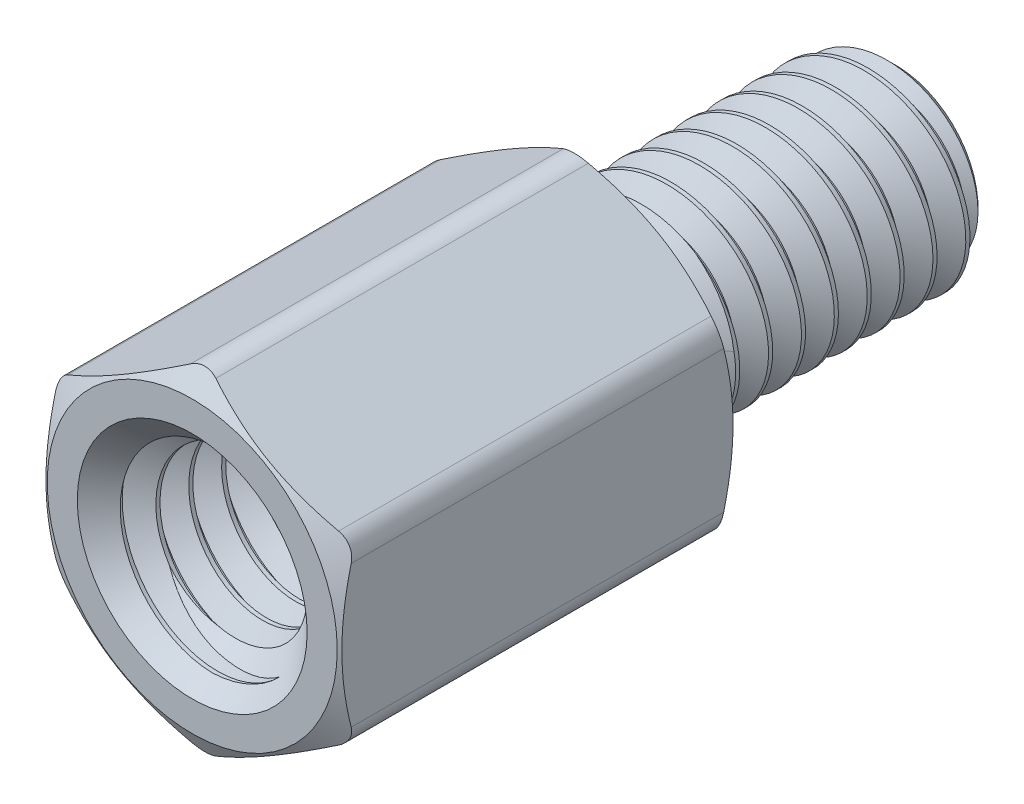
from build123d import *

# Parameters (mm, degrees)
SKETCH4_R           = 1.875
BOSS_EXTRUDE1_DEPTH = 6
SKETCH5_OUTSIDE_W   = 51.438
SKETCH5_OUTSIDE_H   = 52.134
SKETCH5_OUTSIDE_R   = 2.205
CUT_EXTRUDE1_DEPTH  = 12.238438504
CUT_EXTRUDE1_DRAFT  = -60
SKETCH6_OUTSIDE_W   = 36.46
SKETCH6_OUTSIDE_H   = 37.156
SKETCH6_OUTSIDE_R   = 2.205
CUT_EXTRUDE2_DEPTH  = 7.914658343
CUT_EXTRUDE2_DRAFT  = -60
FILLET1_R           = 0.3825
CUT_SWEEP1_PITCH    = 0.5
SKETCH9_R           = 1.75
BOSS_EXTRUDE2_DEPTH = 2.8
SKETCH10_W          = 2.8
SKETCH10_H          = 1.5
CUT_SWEEP2_PITCH    = 0.5


with BuildPart() as part:
    # Sketch3 → Revolve1 (revolve)
    with BuildSketch(Plane(origin=(0, 0, 0), x_dir=(0, 0, -1), z_dir=(1, 0, 0))):
        with BuildLine():
            Line((-3.2, 1.25), (-3.2, 0))
            Line((-3.2, 0), (4.7, 0))
            Line((4.7, 0), (4.7, 1.25))
            Line((4.7, 1.25), (4.45, 1.5))
            Line((4.45, 1.5), (0.7515, 1.5))
            Line((0.7515, 1.5), (0.564, 1.175240474))
            Line((0.564, 1.175240474), (0.25, 1.175240474))
            ThreePointArc((0.25, 1.175240474), (0.073223305, 1.248463778), (0, 1.425240474))
            Line((0, 1.425240474), (0, 2.25))
            Line((0, 2.25), (-6, 2.25))
            Line((-6, 2.25), (-6, 1.75))
            Line((-6, 1.75), (-5.75, 1.5))
            Line((-5.75, 1.5), (-3.45, 1.5))
            Line((-3.45, 1.5), (-3.2, 1.25))
        make_face()
    revolve(axis=Axis((0, 0, -4.7), (0, 0, 1)))

    # Sketch4 → Boss-Extrude1 (add)
    with BuildSketch(Plane.XY.offset(6)):
        Polygon((-2.25, 1.299038106), (-2.25, -1.299038106), (0, -2.598076211), (2.25, -1.299038106), (2.25, 1.299038106), (0, 2.598076211), align=None)
        Circle(SKETCH4_R, mode=Mode.SUBTRACT)
    extrude(amount=-BOSS_EXTRUDE1_DEPTH)


with BuildPart() as cut_extrude1_tool:
    # Sketch5 outside → Cut-Extrude1 (with draft: the straight prism first)
    with BuildSketch(Plane.XY.offset(6)):
        Rectangle(SKETCH5_OUTSIDE_W, SKETCH5_OUTSIDE_H)
        Circle(SKETCH5_OUTSIDE_R, mode=Mode.SUBTRACT)
    extrude(amount=-CUT_EXTRUDE1_DEPTH)
    # Cut-Extrude1: the draft: its side faces are tilted about the plane it starts from
    cut_extrude1_sides = [cut_extrude1_tool.faces().sort_by_distance(p)[0] for p in [
        (0, -26.067, -0.119219252),
        (25.719, 0, -0.119219252),
        (0, 26.067, -0.119219252),
        (-25.719, 0, -0.119219252),
        (-2.205, 0, -0.119219252),
    ]]
    draft(cut_extrude1_sides, Plane.XY.offset(6), CUT_EXTRUDE1_DRAFT)


with BuildPart() as part_1:
    add(part.part)

    # Cut-Extrude1: cut by cut_extrude1_tool
    add(cut_extrude1_tool.part, mode=Mode.SUBTRACT)


with BuildPart() as cut_extrude2_tool:
    # Sketch6 outside → Cut-Extrude2 (with draft: the straight prism first)
    with BuildSketch(Plane(origin=(0, 0, 0), x_dir=(-1, 0, 0), z_dir=(0, 0, -1))):
        Rectangle(SKETCH6_OUTSIDE_W, SKETCH6_OUTSIDE_H)
        Circle(SKETCH6_OUTSIDE_R, mode=Mode.SUBTRACT)
    extrude(amount=-CUT_EXTRUDE2_DEPTH)
    # Cut-Extrude2: the draft: its side faces are tilted about the plane it starts from
    cut_extrude2_sides = [cut_extrude2_tool.faces().sort_by_distance(p)[0] for p in [
        (0, -18.578, 3.957329171),
        (-18.23, 0, 3.957329171),
        (0, 18.578, 3.957329171),
        (18.23, 0, 3.957329171),
        (2.205, 0, 3.957329171),
    ]]
    draft(cut_extrude2_sides, Plane(origin=(0, 0, 0), x_dir=(-1, 0, 0), z_dir=(0, 0, -1)), CUT_EXTRUDE2_DRAFT)


with BuildPart() as part_2:
    add(part_1.part)

    # Cut-Extrude2: cut by cut_extrude2_tool
    add(cut_extrude2_tool.part, mode=Mode.SUBTRACT)

    # Fillet1
    fillet1_edges = [part_2.edges().sort_by_distance(p)[0] for p in [
        (0, 2.598076211, 3),
        (-2.25, -1.299038106, 3),
        (0, -2.598076211, 3),
        (2.25, -1.299038106, 3),
        (2.25, 1.299038106, 3),
        (-2.25, 1.299038106, 3),
    ]]
    fillet(fillet1_edges, radius=FILLET1_R)

    # Cut-Sweep1: the profile of Sketch7 profile screwed along a right-hand helix of 9.118 turns, 6 arcs to a turn; built about Z, then put on its axis
    cut_sweep1_z = Axis((0, 0, 0), (0, 0, 1))
    cut_sweep1_corners = [(1.174940474, 0, -0.187673205), (1.174940474, 0, -0.249826795), (1.527063294, 0, -0.453125), (1.527063294, 0, 0.015625)]
    with BuildLine(mode=Mode.PRIVATE) as cut_sweep1_profile:
        Line(cut_sweep1_corners[0], cut_sweep1_corners[1])
        Line(cut_sweep1_corners[1], cut_sweep1_corners[2])
        Line(cut_sweep1_corners[2], cut_sweep1_corners[3])
        Line(cut_sweep1_corners[3], cut_sweep1_corners[0])
    cut_sweep1_cap = Face(cut_sweep1_profile.wire())
    cut_sweep1_turn_angles = [0, 30, 60, 90, 120, 150, 180, 210, 240, 270, 300, 330, 360]
    cut_sweep1_turn_weights = [1, 0.8660254037844387, 1, 0.8660254037844387, 1, 0.8660254037844387, 1, 0.8660254037844387, 1, 0.8660254037844387, 1, 0.8660254037844387, 1]
    cut_sweep1_turn_rails = [Edge.make_bspline([Vector(p[0], p[1], 0).rotate(cut_sweep1_z, cut_sweep1_turn_angles[k]) / cut_sweep1_turn_weights[k] + Vector(0, 0, p[2] + CUT_SWEEP1_PITCH * cut_sweep1_turn_angles[k] / 360) for k in range(13)], [0, 0, 0, 1, 1, 2, 2, 3, 3, 4, 4, 5, 5, 6, 6, 6], 2, cut_sweep1_turn_weights) for p in cut_sweep1_corners]
    cut_sweep1_turn_sides = [Face.make_surface_from_curves(cut_sweep1_turn_rails[p[0]], cut_sweep1_turn_rails[p[1]]) for p in [(0, 1), (1, 2), (2, 3), (3, 0)]]
    cut_sweep1_last_angles = [3240, 3261.24, 3282.48]
    cut_sweep1_last_weights = [1, 0.9320711124581951, 1]
    cut_sweep1_last_rails = [Edge.make_bspline([Vector(p[0], p[1], 0).rotate(cut_sweep1_z, cut_sweep1_last_angles[k]) / cut_sweep1_last_weights[k] + Vector(0, 0, p[2] + CUT_SWEEP1_PITCH * cut_sweep1_last_angles[k] / 360) for k in range(3)], [0, 0, 0, 1, 1, 1], 2, cut_sweep1_last_weights) for p in cut_sweep1_corners]
    cut_sweep1_last_sides = [Face.make_surface_from_curves(cut_sweep1_last_rails[p[0]], cut_sweep1_last_rails[p[1]]) for p in [(0, 1), (1, 2), (2, 3), (3, 0)]]
    cut_sweep1 = Plane(origin=(0, 0, -4.7), x_dir=(0, 1, 0), z_dir=(0, 0, 1)) * Solid(Shell([*[p.moved(Location((0, 0, CUT_SWEEP1_PITCH * i))) for i in range(9) for p in cut_sweep1_turn_sides], *cut_sweep1_last_sides, cut_sweep1_cap, cut_sweep1_cap.rotate(cut_sweep1_z, 3282.48).moved(Location((0, 0, CUT_SWEEP1_PITCH * 3282.48 / 360)))]))
    add(cut_sweep1, mode=Mode.SUBTRACT)

    # Sketch9 → Boss-Extrude2 (add)
    with BuildSketch(Plane.XY.offset(3.2)):
        Circle(SKETCH9_R)
    extrude(amount=BOSS_EXTRUDE2_DEPTH)


with BuildPart() as body_2:
    # Sketch10 → Revolve2 (revolve)
    with BuildSketch(Plane(origin=(0, 0, 0), x_dir=(0, 0, -1), z_dir=(1, 0, 0))):
        with Locations((-4.6, 0.75)):
            Rectangle(SKETCH10_W, SKETCH10_H)
    revolve(axis=Axis((0, 0, -4.7), (0, 0, 1)))

    # Cut-Sweep2: the profile of Sketch12 profile screwed along a right-hand helix of 6.6 turns, 6 arcs to a turn; built about Z, then put on its axis
    cut_sweep2_z = Axis((0, 0, 0), (0, 0, 1))
    cut_sweep2_corners = [(1.174940474, 0, -0.249826795), (1.174940474, 0, -0.187673205), (1.527063294, 0, 0.015625), (1.527063294, 0, -0.453125)]
    with BuildLine(mode=Mode.PRIVATE) as cut_sweep2_profile:
        Line(cut_sweep2_corners[0], cut_sweep2_corners[1])
        Line(cut_sweep2_corners[1], cut_sweep2_corners[2])
        Line(cut_sweep2_corners[2], cut_sweep2_corners[3])
        Line(cut_sweep2_corners[3], cut_sweep2_corners[0])
    cut_sweep2_cap = Face(cut_sweep2_profile.wire())
    cut_sweep2_turn_angles = [0, 30, 60, 90, 120, 150, 180, 210, 240, 270, 300, 330, 360]
    cut_sweep2_turn_weights = [1, 0.8660254037844387, 1, 0.8660254037844387, 1, 0.8660254037844387, 1, 0.8660254037844387, 1, 0.8660254037844387, 1, 0.8660254037844387, 1]
    cut_sweep2_turn_rails = [Edge.make_bspline([Vector(p[0], p[1], 0).rotate(cut_sweep2_z, cut_sweep2_turn_angles[k]) / cut_sweep2_turn_weights[k] + Vector(0, 0, p[2] + CUT_SWEEP2_PITCH * cut_sweep2_turn_angles[k] / 360) for k in range(13)], [0, 0, 0, 1, 1, 2, 2, 3, 3, 4, 4, 5, 5, 6, 6, 6], 2, cut_sweep2_turn_weights) for p in cut_sweep2_corners]
    cut_sweep2_turn_sides = [Face.make_surface_from_curves(cut_sweep2_turn_rails[p[0]], cut_sweep2_turn_rails[p[1]]) for p in [(0, 1), (1, 2), (2, 3), (3, 0)]]
    cut_sweep2_last_angles = [2160, 2190, 2220, 2250, 2280, 2310, 2340, 2358, 2376]
    cut_sweep2_last_weights = [1, 0.8660254037844387, 1, 0.8660254037844387, 1, 0.8660254037844387, 1, 0.9510565162951389, 1]
    cut_sweep2_last_rails = [Edge.make_bspline([Vector(p[0], p[1], 0).rotate(cut_sweep2_z, cut_sweep2_last_angles[k]) / cut_sweep2_last_weights[k] + Vector(0, 0, p[2] + CUT_SWEEP2_PITCH * cut_sweep2_last_angles[k] / 360) for k in range(9)], [0, 0, 0, 1, 1, 2, 2, 3, 3, 4, 4, 4], 2, cut_sweep2_last_weights) for p in cut_sweep2_corners]
    cut_sweep2_last_sides = [Face.make_surface_from_curves(cut_sweep2_last_rails[p[0]], cut_sweep2_last_rails[p[1]]) for p in [(0, 1), (1, 2), (2, 3), (3, 0)]]
    cut_sweep2 = Plane(origin=(0, 0, 6), x_dir=(0, 1, 0), z_dir=(0, 0, -1)) * Solid(Shell([*[p.moved(Location((0, 0, CUT_SWEEP2_PITCH * i))) for i in range(6) for p in cut_sweep2_turn_sides], *cut_sweep2_last_sides, cut_sweep2_cap, cut_sweep2_cap.rotate(cut_sweep2_z, 2376).moved(Location((0, 0, CUT_SWEEP2_PITCH * 2376 / 360)))]))
    add(cut_sweep2, mode=Mode.SUBTRACT)


with BuildPart() as part_3:
    add(part_2.part)

    # Combine1: cut body 2
    add(body_2.part, mode=Mode.SUBTRACT)

    # Cut-Extrude3 cone 1 section (through the dimple's axis) → Cut-Extrude3 (revolve, cut)
    with BuildSketch(Plane(origin=(0, 0, 6), x_dir=(0, -1, 0), z_dir=(1, 0, 0))):
        Polygon((0, 0), (1.7475, 0), (0, 1.7475), align=None)
    revolve(axis=Axis((0, 0, 6), (0, 0, -1)), mode=Mode.SUBTRACT)


solid = part_3.part
